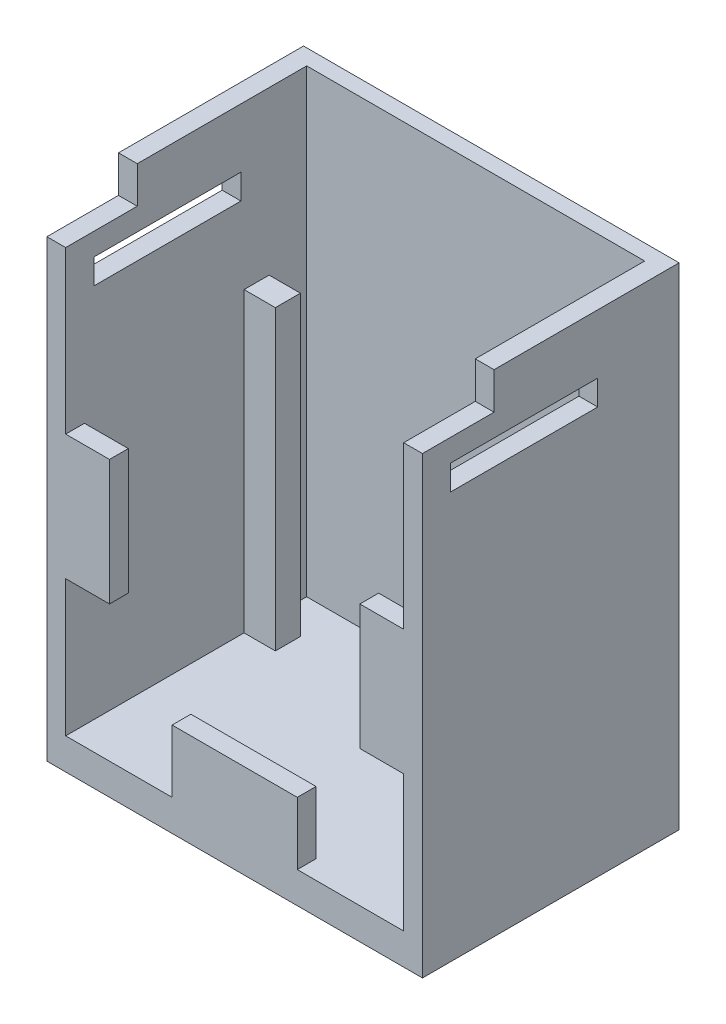
from build123d import *

# Parameters (mm, degrees)
INITIAL_BLOCK_DEPTH      = 19.05
INITIAL_BLOCK_DEPTH_BACK = 1.778
SKETCH1_W                = 30.48
SKETCH1_H                = 40.64
SKETCH2_W                = 27.432
SKETCH2_H                = 19.558
INITIAL_CUT_DEPTH        = 38.1
SKETCH20_W               = 5.08
SKETCH20_H               = 10.16
SKETCH20_W_2             = 10.16
SKETCH20_H_2             = 5.08
BOSS_EXTRUDE1_DEPTH      = 1.524
SKETCH21_W               = 2.032
SKETCH21_H               = 24.13
BOSS_EXTRUDE2_DEPTH      = 2.54
CUT_EXTRUDE6_REACH       = 46.012
SKETCH27_W               = 11.938
SKETCH27_H               = 2.032
SKETCH28_W               = 30.48
SKETCH28_H               = 1.778
CUT_EXTRUDE7_DEPTH       = 37.210815843
SKETCH29_W               = 30.48
SKETCH29_H               = 2
CUT_EXTRUDE8_DEPTH       = 5.81
BOSS_EXTRUDE3_DEPTH      = 0.99


with BuildPart() as part:
    # Sketch1 → Initial Block (new, two sides: drawn at the far end of the back side and taken through both)
    with BuildSketch(Plane.XY.offset(-INITIAL_BLOCK_DEPTH_BACK)):
        with Locations((0, -5.08)):
            Rectangle(SKETCH1_W, SKETCH1_H)
    extrude(amount=INITIAL_BLOCK_DEPTH + INITIAL_BLOCK_DEPTH_BACK)

    # Sketch2 → Initial Cut (cut)
    with BuildSketch(Plane(origin=(0, 15.24, 0), x_dir=(1, 0, 0), z_dir=(0, 1, 0))):
        with Locations((0, -9.271)):
            Rectangle(SKETCH2_W, SKETCH2_H)
    extrude(amount=-INITIAL_CUT_DEPTH, mode=Mode.SUBTRACT)

    # Sketch20 → Boss-Extrude1 (add)
    with BuildSketch(Plane.XY.offset(19.05)):
        with Locations((-12.7, -6.731)):
            Rectangle(SKETCH20_W, SKETCH20_H)
        with Locations((12.7, -6.731)):
            Rectangle(SKETCH20_W, SKETCH20_H)
        with Locations((0, -20.32)):
            Rectangle(SKETCH20_W_2, SKETCH20_H_2)
    extrude(amount=-BOSS_EXTRUDE1_DEPTH)

    # Sketch21 → Boss-Extrude2 (add)
    with BuildSketch(Plane(origin=(-13.716, 0, 0), x_dir=(0, 0, -1), z_dir=(1, 0, 0))):
        with Locations((-3.556, -10.795)):
            Rectangle(SKETCH21_W, SKETCH21_H)
    boss_extrude2 = extrude(amount=BOSS_EXTRUDE2_DEPTH)

    # Mirror2: Boss-Extrude2 across plane
    add(boss_extrude2.mirror(Plane(origin=(0, 0, 0), x_dir=(0, 0, 1), z_dir=(1, 0, 0))))

    # Sketch27 → Cut-Extrude6 (cut, up to next)
    with BuildSketch(Plane(origin=(15.24, 0, 0), x_dir=(0, 0, -1), z_dir=(1, 0, 0)), mode=Mode.PRIVATE) as cut_extrude6_sk1:
        with Locations((-10.795, 8.636)):
            Rectangle(SKETCH27_W, SKETCH27_H)
    cut_extrude6_tool1 = extrude(cut_extrude6_sk1.sketch, amount=-CUT_EXTRUDE6_REACH, mode=Mode.PRIVATE) & part.part
    cut_extrude6 = cut_extrude6_tool1.solids().sort_by_distance((15.24, 8.636, 10.795))[0]
    add(cut_extrude6, mode=Mode.SUBTRACT)

    # Mirror6: Cut-Extrude6 across plane
    add(cut_extrude6.mirror(Plane(origin=(0, 0, 0), x_dir=(0, 0, 1), z_dir=(1, 0, 0))), mode=Mode.SUBTRACT)

    # Sketch28 → Cut-Extrude7 (cut, through all)
    with BuildSketch(Plane.XY.offset(19.05)):
        with Locations((0, 14.351)):
            Rectangle(SKETCH28_W, SKETCH28_H)
    extrude(amount=-CUT_EXTRUDE7_DEPTH, mode=Mode.SUBTRACT)

    # Sketch29 → Cut-Extrude8 (cut)
    with BuildSketch(Plane.XY.offset(19.05)):
        with Locations((0, 12.462)):
            Rectangle(SKETCH29_W, SKETCH29_H)
    extrude(amount=-CUT_EXTRUDE8_DEPTH, mode=Mode.SUBTRACT)

    # Sketch30 → Boss-Extrude3 (add)
    with BuildSketch(Plane(origin=(0, 13.462, 0), x_dir=(1, 0, 0), z_dir=(0, 1, 0))):
        Polygon((-15.24, -13.24), (-15.24, 1.778), (15.24, 1.778), (15.24, -13.24), (13.716, -13.24), (13.716, 0.508), (-13.716, 0.508), (-13.716, -13.24), align=None)
    extrude(amount=BOSS_EXTRUDE3_DEPTH)


solid = part.part
